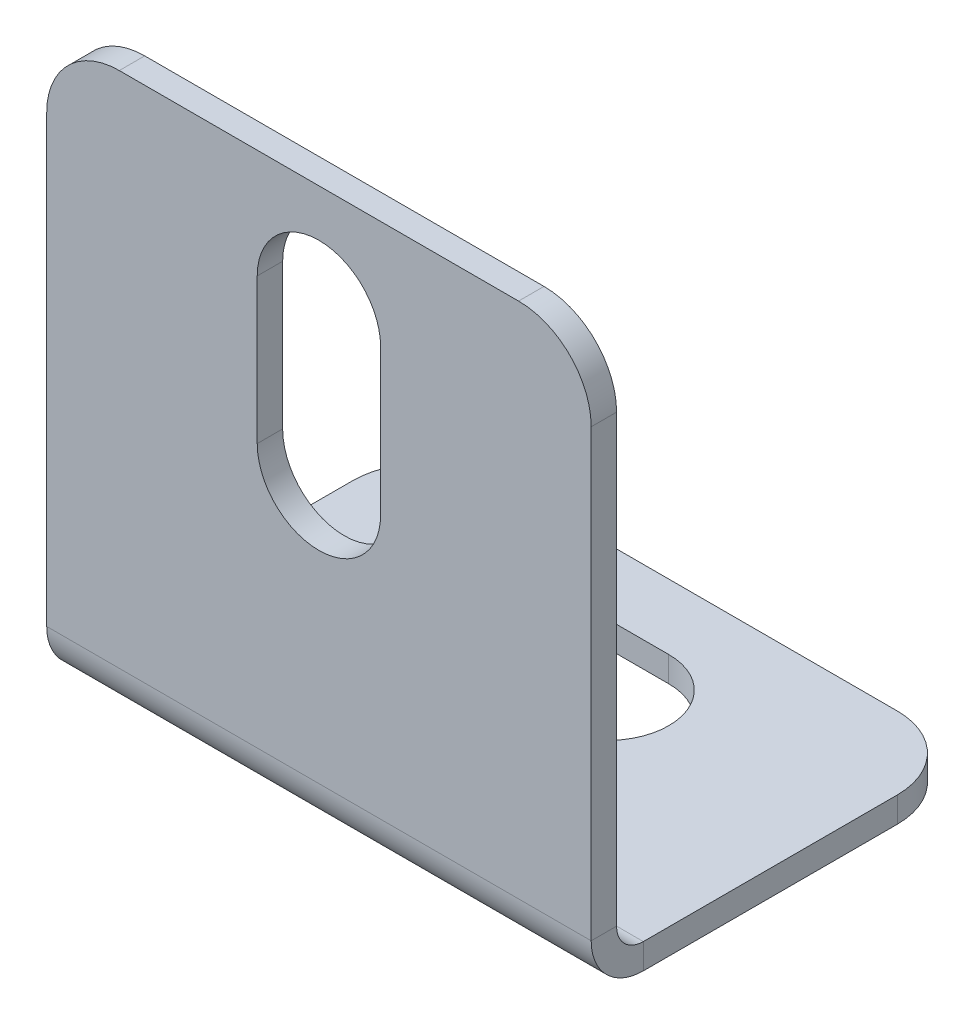
from build123d import *

# Parameters (mm, degrees)
SKETCH1_W          = 15
SKETCH1_H          = 9
BASE_FLANGE1_DEPTH = 0.7
EDGE_FLANGE1_DEPTH = 15
CUT_EXTRUDE1_DEPTH = 10
FILLET1_R          = 2
CUT_EXTRUDE2_DEPTH = 10


# Sheet-metal steps are written as plain solids
with BuildPart() as part:
    # Sketch1 → Base-Flange1 (new body)
    with BuildSketch(Plane(origin=(0, 0, 0), x_dir=(1, 0, 0), z_dir=(0, 1, 0))):
        with Locations((7.5, -4.5)):
            Rectangle(SKETCH1_W, SKETCH1_H)
    extrude(amount=-BASE_FLANGE1_DEPTH)

    # Edge-Flange1 section (across the edge) → Edge-Flange1 (add)
    with BuildSketch(Plane(origin=(0, 0, 9.7366), x_dir=(0, 0, -1), z_dir=(1, 0, 0))):
        with BuildLine():
            Line((-0.7, 0.7366), (-0.7, 15))
            Line((-0.7, 15), (0, 15))
            Line((0, 15), (0, 0.7366))
            ThreePointArc((0, 0.7366), (0.215745145, 0.215745145), (0.7366, 0))
            Line((0.7366, 0), (0.7366, -0.7))
            ThreePointArc((0.7366, -0.7), (-0.279229602, -0.279229602), (-0.7, 0.7366))
        make_face()
    extrude(amount=EDGE_FLANGE1_DEPTH)

    # Sketch7 → Cut-Extrude1 (cut)
    with BuildSketch(Plane(origin=(0, 0, 0), x_dir=(1, 0, 0), z_dir=(0, 1, 0))):
        with BuildLine():
            Line((8.5, -5.2), (6.5, -5.2))
            ThreePointArc((6.5, -5.2), (4.8, -3.5), (6.5, -1.8))
            Line((6.5, -1.8), (8.5, -1.8))
            ThreePointArc((8.5, -1.8), (10.2, -3.5), (8.5, -5.2))
        make_face()
    extrude(amount=-CUT_EXTRUDE1_DEPTH, mode=Mode.SUBTRACT)

    # Fillet1
    fillet1_edges = [part.edges().sort_by_distance(p)[0] for p in [
        (0, 15, 10.0866),
        (15, 15, 10.0866),
        (0, -0.35, 0),
        (15, -0.35, 0),
    ]]
    fillet(fillet1_edges, radius=FILLET1_R)

    # Sketch8 → Cut-Extrude2 (cut)
    with BuildSketch(Plane(origin=(0, 0, 9.7366), x_dir=(-1, 0, 0), z_dir=(0, 0, -1))):
        with BuildLine():
            Line((-5.8, 12), (-5.8, 8))
            ThreePointArc((-5.8, 8), (-7.5, 6.3), (-9.2, 8))
            Line((-9.2, 8), (-9.2, 12))
            ThreePointArc((-9.2, 12), (-7.5, 13.7), (-5.8, 12))
        make_face()
    extrude(amount=-CUT_EXTRUDE2_DEPTH, mode=Mode.SUBTRACT)


solid = part.part
